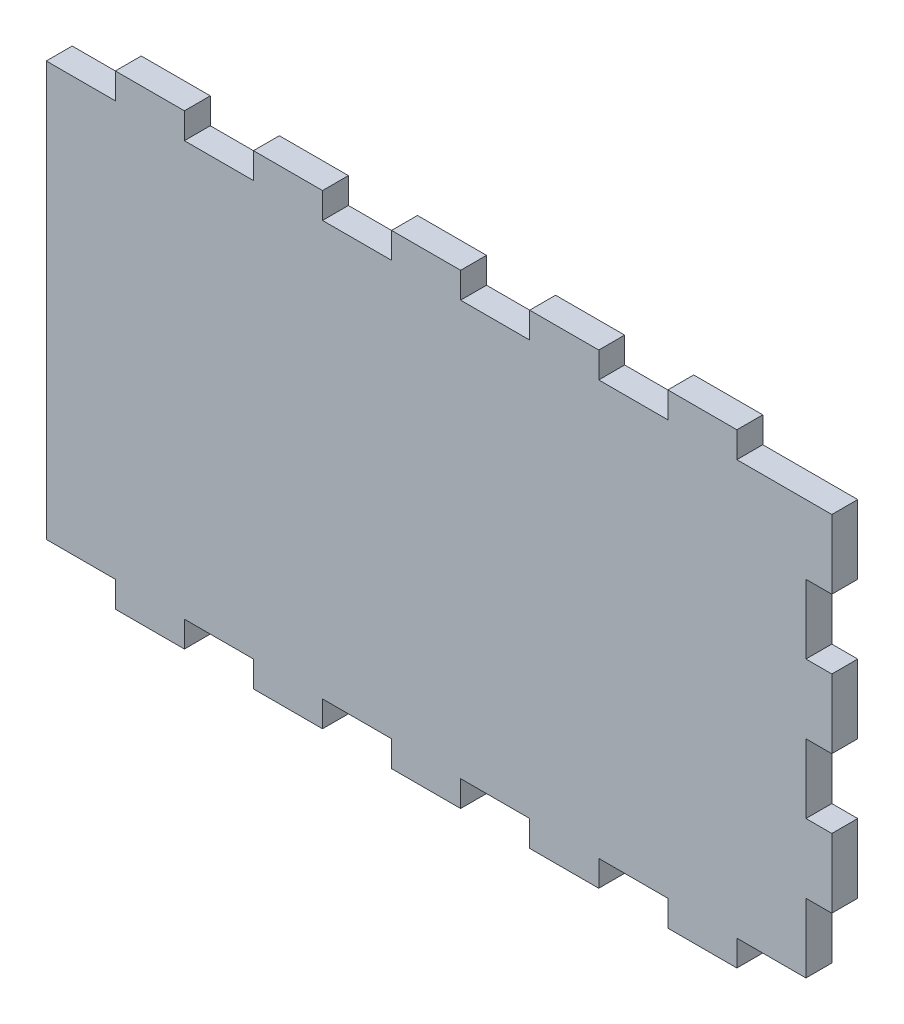
from build123d import *

# Parameters (mm, degrees)
SKETCH1_W               = 279.4
SKETCH1_H               = 152.4
BOSS_EXTRUDE1_DEPTH     = 9.525
SKETCH2_W               = 25.4
SKETCH2_H               = 9.525
BOSS_EXTRUDE2_DEPTH     = 9.525
LPATTERN1_COUNT         = 5
LPATTERN1_PITCH         = 50.8
MIRROR1_COPY_1_SKETCH_W = 25.4
MIRROR1_COPY_1_SKETCH_H = 9.525
MIRROR1_COPY_1_DEPTH    = 9.525
MIRROR1_COPY_2_SKETCH_W = 25.4
MIRROR1_COPY_2_SKETCH_H = 9.525
MIRROR1_COPY_2_DEPTH    = 9.525
MIRROR1_COPY_3_SKETCH_W = 25.4
MIRROR1_COPY_3_SKETCH_H = 9.525
MIRROR1_COPY_3_DEPTH    = 9.525
MIRROR1_COPY_4_SKETCH_W = 25.4
MIRROR1_COPY_4_SKETCH_H = 9.525
MIRROR1_COPY_4_DEPTH    = 9.525
MIRROR1_COPY_5_SKETCH_W = 25.4
MIRROR1_COPY_5_SKETCH_H = 9.525
MIRROR1_COPY_5_DEPTH    = 9.525
SKETCH3_W               = 9.525
SKETCH3_H               = 25.4
BOSS_EXTRUDE3_DEPTH     = 9.525
LPATTERN2_COUNT         = 3
LPATTERN2_PITCH         = 50.8


with BuildPart() as part:
    # Sketch1 → Boss-Extrude1 (new body)
    with BuildSketch(Plane.XY):
        Rectangle(SKETCH1_W, SKETCH1_H)
    extrude(amount=BOSS_EXTRUDE1_DEPTH)

    # Sketch2 → Boss-Extrude2 (add)
    with BuildSketch(Plane.XZ.offset(76.2)):
        with Locations((-101.6, 4.7625)):
            Rectangle(SKETCH2_W, SKETCH2_H)
    boss_extrude2 = extrude(amount=BOSS_EXTRUDE2_DEPTH)

    # LPattern1: Boss-Extrude2 ×5
    with Locations(*[(i * LPATTERN1_PITCH, 0, 0) for i in range(1, LPATTERN1_COUNT)]):
        add(boss_extrude2)

    # Mirror1 copy 1 sketch → Mirror1 copy 1 (add)
    with BuildSketch(Plane(origin=(50.8, 76.2, 0), x_dir=(1, 0, 0), z_dir=(0, 1, 0))):
        with Locations((-101.6, -4.7625)):
            Rectangle(MIRROR1_COPY_1_SKETCH_W, MIRROR1_COPY_1_SKETCH_H)
    extrude(amount=MIRROR1_COPY_1_DEPTH)

    # Mirror1 copy 2 sketch → Mirror1 copy 2 (add)
    with BuildSketch(Plane(origin=(101.6, 76.2, 0), x_dir=(1, 0, 0), z_dir=(0, 1, 0))):
        with Locations((-101.6, -4.7625)):
            Rectangle(MIRROR1_COPY_2_SKETCH_W, MIRROR1_COPY_2_SKETCH_H)
    extrude(amount=MIRROR1_COPY_2_DEPTH)

    # Mirror1 copy 3 sketch → Mirror1 copy 3 (add)
    with BuildSketch(Plane(origin=(152.4, 76.2, 0), x_dir=(1, 0, 0), z_dir=(0, 1, 0))):
        with Locations((-101.6, -4.7625)):
            Rectangle(MIRROR1_COPY_3_SKETCH_W, MIRROR1_COPY_3_SKETCH_H)
    extrude(amount=MIRROR1_COPY_3_DEPTH)

    # Mirror1 copy 4 sketch → Mirror1 copy 4 (add)
    with BuildSketch(Plane(origin=(203.2, 76.2, 0), x_dir=(1, 0, 0), z_dir=(0, 1, 0))):
        with Locations((-101.6, -4.7625)):
            Rectangle(MIRROR1_COPY_4_SKETCH_W, MIRROR1_COPY_4_SKETCH_H)
    extrude(amount=MIRROR1_COPY_4_DEPTH)

    # Mirror1 copy 5 sketch → Mirror1 copy 5 (add)
    with BuildSketch(Plane(origin=(0, 76.2, 0), x_dir=(1, 0, 0), z_dir=(0, 1, 0))):
        with Locations((-101.6, -4.7625)):
            Rectangle(MIRROR1_COPY_5_SKETCH_W, MIRROR1_COPY_5_SKETCH_H)
    extrude(amount=MIRROR1_COPY_5_DEPTH)

    # Sketch3 → Boss-Extrude3 (add)
    with BuildSketch(Plane(origin=(139.7, 0, 0), x_dir=(0, 0, -1), z_dir=(1, 0, 0))):
        with Locations((-4.7625, 63.5)):
            Rectangle(SKETCH3_W, SKETCH3_H)
    boss_extrude3 = extrude(amount=BOSS_EXTRUDE3_DEPTH)

    # LPattern2: Boss-Extrude3 ×3
    with Locations(*[(0, -i * LPATTERN2_PITCH, 0) for i in range(1, LPATTERN2_COUNT)]):
        add(boss_extrude3)


solid = part.part
